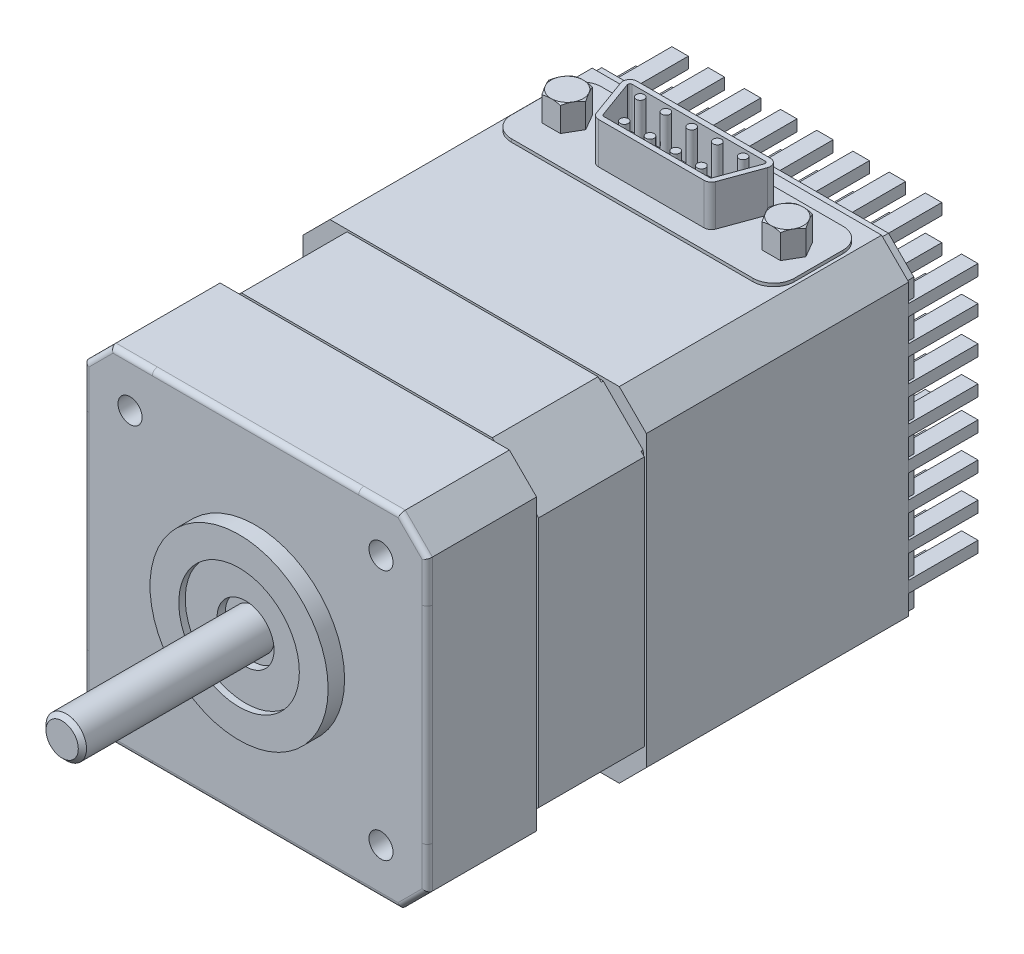
from build123d import *

# Parameters (mm, degrees)
EXTRUDE1_DEPTH          = 68.072
CUT_EXTRUDE_THIN1_DEPTH = 0.127
CUT_EXTRUDE_THIN2_DEPTH = 0.127
SKETCH5_R               = 10.9982
EXTRUDE2_DEPTH          = 2.032
SKETCH6_R               = 2.5019
EXTRUDE3_DEPTH          = 23.876
CHAMFER1_SIZE           = 0.508
SKETCH7_R               = 1.4859
CUT_EXTRUDE1_DEPTH      = 3.9624
CUT_EXTRUDE3_START      = -0.8001
SKETCH9_R               = 7.4422
SKETCH9_R_2             = 2.5019
CUT_EXTRUDE3_DEPTH      = 0.8001
CUT_EXTRUDE2_START      = -1.016
SKETCH8_R               = 3.5179
SKETCH8_R_2             = 2.5019
CUT_EXTRUDE2_DEPTH      = 1.016
CUT_EXTRUDE4_START      = -7.9375
CUT_EXTRUDE4_DEPTH      = 7.9375
FILLET1_R               = 1.016
FILLET2_R               = 0.635
SKETCH11_R              = 5.08
EXTRUDE4_DEPTH          = 0.508
DOME1_FACE_RADIUS       = 5.08
DOME1_HEIGHT            = 3.96875
DOME2_FACE_RADIUS       = 5.08
DOME2_HEIGHT            = 3.96875
DOME3_FACE_RADIUS       = 5.08
DOME3_HEIGHT            = 3.96875
DOME4_FACE_RADIUS       = 5.08
DOME4_HEIGHT            = 3.96875
EXTRUDE9_DEPTH          = 13.4874
FILLET7_R               = 0.635
EXTRUDE10_DEPTH         = 33.0835
CUT_EXTRUDE7_START      = -13.3096
CUT_EXTRUDE7_DEPTH      = 13.3096
CUT_EXTRUDE8_START      = -7.9375
SKETCH23_R              = 5.08
CUT_EXTRUDE8_DEPTH      = 7.9375
EXTRUDE14_DEPTH         = 7.9375
EXTRUDE14_DEPTH_BACK    = 0.635
SKETCH31_W              = 42.418
SKETCH31_H              = 42.418
SKETCH32_W              = 42.418
SKETCH32_H              = 42.418
CUT_EXTRUDE12_DEPTH     = 7.62
SKETCH33_W              = 42.418
SKETCH33_H              = 42.418
CUT_EXTRUDE13_DEPTH     = 1.016
EXTRUDE15_START         = -1.016
SKETCH34_W              = 2.032
SKETCH34_H              = 1.397
EXTRUDE15_DEPTH         = 8.636
LPATTERN2_COUNT         = 5
LPATTERN2_PITCH         = 4.2926
MIRROR1_START           = -1.016
MIRROR1_COPY_1_SKETCH_W = 2.032
MIRROR1_COPY_1_SKETCH_H = 1.397
MIRROR1_COPY_1_DEPTH    = 8.636
MIRROR1_COPY_2_SKETCH_W = 2.032
MIRROR1_COPY_2_SKETCH_H = 1.397
MIRROR1_COPY_2_DEPTH    = 8.636
MIRROR1_COPY_3_SKETCH_W = 2.032
MIRROR1_COPY_3_SKETCH_H = 1.397
MIRROR1_COPY_3_DEPTH    = 8.636
MIRROR1_COPY_4_SKETCH_W = 2.032
MIRROR1_COPY_4_SKETCH_H = 1.397
MIRROR1_COPY_4_DEPTH    = 8.636
SKETCH35_W              = 2.032
SKETCH35_H              = 1.397
CUT_EXTRUDE14_DEPTH     = 90.503379523
CUT_EXTRUDE16_DEPTH     = 1.27
SKETCH25_W              = 34.925
SKETCH25_H              = 11.1125
EXTRUDE11_DEPTH         = 0.381
EXTRUDE12_DEPTH         = 3.175
SKETCH29_OUTSIDE_W      = 69.3
SKETCH29_OUTSIDE_H      = 118.83
SKETCH29_OUTSIDE_R      = 1.9812
CUT_EXTRUDE11_DEPTH     = 0.762
CUT_EXTRUDE11_DRAFT     = -60
EXTRUDE13_DEPTH         = 5.08
FILLET8_R               = 0.889
SKETCH28_R              = 0.508
CUT_EXTRUDE10_DEPTH     = 5.08
FILLET9_R               = 2.54


with BuildPart() as part:
    # Sketch2 → Extrude1 (new body)
    with BuildSketch(Plane.XY):
        with BuildLine():
            Line((-15.494, 21.209), (15.494, 21.209))
            ThreePointArc((15.494, 21.209), (19.535115254, 19.535115254), (21.209, 15.494))
            Line((21.209, 15.494), (21.209, -15.494))
            ThreePointArc((21.209, -15.494), (19.535115254, -19.535115254), (15.494, -21.209))
            Line((15.494, -21.209), (-15.494, -21.209))
            ThreePointArc((-15.494, -21.209), (-19.535115254, -19.535115254), (-21.209, -15.494))
            Line((-21.209, -15.494), (-21.209, 15.494))
            ThreePointArc((-21.209, 15.494), (-19.535115254, 19.535115254), (-15.494, 21.209))
        make_face()
    extrude(amount=-EXTRUDE1_DEPTH)

    # Sketch3 → Cut-Extrude-Thin1 (cut, symmetric)
    with BuildSketch(Plane.XY.offset(-13.6144)):
        with BuildLine():
            Line((15.494, 21.59), (-15.494, 21.59))
            ThreePointArc((-15.494, 21.59), (-19.804522938, 19.804522938), (-21.59, 15.494))
            Line((-21.59, 15.494), (-21.59, -15.494))
            ThreePointArc((-21.59, -15.494), (-19.804522938, -19.804522938), (-15.494, -21.59))
            Line((-15.494, -21.59), (15.494, -21.59))
            ThreePointArc((15.494, -21.59), (19.804522938, -19.804522938), (21.59, -15.494))
            Line((21.59, -15.494), (21.59, 15.494))
            ThreePointArc((21.59, 15.494), (19.804522938, 19.804522938), (15.494, 21.59))
        make_face()
        with BuildLine():
            Line((15.494, 20.828), (-15.494, 20.828))
            ThreePointArc((-15.494, 20.828), (-19.265707571, 19.265707571), (-20.828, 15.494))
            Line((-20.828, 15.494), (-20.828, -15.494))
            ThreePointArc((-20.828, -15.494), (-19.265707571, -19.265707571), (-15.494, -20.828))
            Line((-15.494, -20.828), (15.494, -20.828))
            ThreePointArc((15.494, -20.828), (19.265707571, -19.265707571), (20.828, -15.494))
            Line((20.828, -15.494), (20.828, 15.494))
            ThreePointArc((20.828, 15.494), (19.265707571, 19.265707571), (15.494, 20.828))
        make_face(mode=Mode.SUBTRACT)
    extrude(amount=CUT_EXTRUDE_THIN1_DEPTH, both=True, mode=Mode.SUBTRACT)

    # Sketch4 → Cut-Extrude-Thin2 (cut, symmetric)
    with BuildSketch(Plane(origin=(0, 0, -26.924), x_dir=(-1, 0, 0), z_dir=(0, 0, -1))):
        with BuildLine():
            Line((15.494, 21.59), (-15.494, 21.59))
            ThreePointArc((-15.494, 21.59), (-19.804522938, 19.804522938), (-21.59, 15.494))
            Line((-21.59, 15.494), (-21.59, -15.494))
            ThreePointArc((-21.59, -15.494), (-19.804522938, -19.804522938), (-15.494, -21.59))
            Line((-15.494, -21.59), (15.494, -21.59))
            ThreePointArc((15.494, -21.59), (19.804522938, -19.804522938), (21.59, -15.494))
            Line((21.59, -15.494), (21.59, 15.494))
            ThreePointArc((21.59, 15.494), (19.804522938, 19.804522938), (15.494, 21.59))
        make_face()
        with BuildLine():
            Line((15.494, 20.828), (-15.494, 20.828))
            ThreePointArc((-15.494, 20.828), (-19.265707571, 19.265707571), (-20.828, 15.494))
            Line((-20.828, 15.494), (-20.828, -15.494))
            ThreePointArc((-20.828, -15.494), (-19.265707571, -19.265707571), (-15.494, -20.828))
            Line((-15.494, -20.828), (15.494, -20.828))
            ThreePointArc((15.494, -20.828), (19.265707571, -19.265707571), (20.828, -15.494))
            Line((20.828, -15.494), (20.828, 15.494))
            ThreePointArc((20.828, 15.494), (19.265707571, 19.265707571), (15.494, 20.828))
        make_face(mode=Mode.SUBTRACT)
    extrude(amount=CUT_EXTRUDE_THIN2_DEPTH, both=True, mode=Mode.SUBTRACT)

    # Sketch5 → Extrude2 (add)
    with BuildSketch(Plane.XY):
        Circle(SKETCH5_R)
    extrude(amount=EXTRUDE2_DEPTH)

    # Sketch6 → Extrude3 (add)
    with BuildSketch(Plane.XY):
        Circle(SKETCH6_R)
    extrude(amount=EXTRUDE3_DEPTH)

    # Chamfer1
    chamfer1_edges = [part.edges().sort_by_distance(p)[0] for p in [
        (-2.5019, 0, 23.876),
    ]]
    chamfer(chamfer1_edges, length=CHAMFER1_SIZE)

    # Sketch7 → Cut-Extrude1 (cut)
    with BuildSketch(Plane.XY):
        with Locations((15.494, 15.494)):
            Circle(SKETCH7_R)
        with Locations((15.494, -15.494)):
            Circle(SKETCH7_R)
        with Locations((-15.494, -15.494)):
            Circle(SKETCH7_R)
        with Locations((-15.494, 15.494)):
            Circle(SKETCH7_R)
    extrude(amount=-CUT_EXTRUDE1_DEPTH, mode=Mode.SUBTRACT)

    # Sketch9 → Cut-Extrude3 (cut)
    with BuildSketch(Plane.XY.offset(2.032).offset(CUT_EXTRUDE3_START)):
        Circle(SKETCH9_R)
        Circle(SKETCH9_R_2, mode=Mode.SUBTRACT)
    extrude(amount=CUT_EXTRUDE3_DEPTH, mode=Mode.SUBTRACT)

    # Sketch8 → Cut-Extrude2 (cut)
    with BuildSketch(Plane.XY.offset(1.2319).offset(CUT_EXTRUDE2_START)):
        Circle(SKETCH8_R)
        Circle(SKETCH8_R_2, mode=Mode.SUBTRACT)
    extrude(amount=CUT_EXTRUDE2_DEPTH, mode=Mode.SUBTRACT)

    # Sketch10 → Cut-Extrude4 (cut)
    with BuildSketch(Plane(origin=(0, 0, -68.072), x_dir=(-1, 0, 0), z_dir=(0, 0, -1)).offset(CUT_EXTRUDE4_START)):
        with BuildLine():
            Line((9.779, 15.494), (9.779, 21.209))
            Line((9.779, 21.209), (21.209, 21.209))
            Line((21.209, 21.209), (21.209, 9.779))
            Line((21.209, 9.779), (15.494, 9.779))
            ThreePointArc((15.494, 9.779), (11.452884746, 11.452884746), (9.779, 15.494))
        make_face()
        with BuildLine():
            Line((-9.779, 15.494), (-9.779, 21.209))
            Line((-9.779, 21.209), (-21.209, 21.209))
            Line((-21.209, 21.209), (-21.209, 9.779))
            Line((-21.209, 9.779), (-15.494, 9.779))
            ThreePointArc((-15.494, 9.779), (-11.452884746, 11.452884746), (-9.779, 15.494))
        make_face()
        with BuildLine():
            Line((-21.209, -9.779), (-15.494, -9.779))
            ThreePointArc((-15.494, -9.779), (-11.452884746, -11.452884746), (-9.779, -15.494))
            Line((-9.779, -15.494), (-9.779, -21.209))
            Line((-9.779, -21.209), (-21.209, -21.209))
            Line((-21.209, -21.209), (-21.209, -9.779))
        make_face()
        with BuildLine():
            Line((9.779, -15.494), (9.779, -21.209))
            Line((9.779, -21.209), (21.209, -21.209))
            Line((21.209, -21.209), (21.209, -9.779))
            Line((21.209, -9.779), (15.494, -9.779))
            ThreePointArc((15.494, -9.779), (11.452884746, -11.452884746), (9.779, -15.494))
        make_face()
    extrude(amount=CUT_EXTRUDE4_DEPTH, mode=Mode.SUBTRACT)

    # Fillet1
    fillet1_edges = [part.edges().sort_by_distance(p)[0] for p in [
        (-9.779, 21.209, -64.10325),
        (-21.209, 9.779, -64.10325),
        (21.209, 9.779, -64.10325),
        (9.779, 21.209, -64.10325),
        (9.779, -21.209, -64.10325),
        (21.209, -9.779, -64.10325),
        (-9.779, -21.209, -64.10325),
        (-21.209, -9.779, -64.10325),
    ]]
    fillet(fillet1_edges, radius=FILLET1_R)

    # Fillet2
    fillet2_edges = [part.edges().sort_by_distance(p)[0] for p in [
        (-19.535115254, 19.535115254, -60.1345),
        (-21.209, 12.1285, -60.1345),
        (-12.1285, 21.209, -60.1345),
        (-11.452884746, 11.452884746, -68.072),
        (-17.8435, 9.779, -68.072),
        (12.1285, 21.209, -60.1345),
        (21.209, 12.1285, -60.1345),
        (19.535115254, 19.535115254, -60.1345),
        (11.452884746, 11.452884746, -68.072),
        (9.779, 17.8435, -68.072),
        (21.209, -12.1285, -60.1345),
        (12.1285, -21.209, -60.1345),
        (19.535115254, -19.535115254, -60.1345),
        (11.452884746, -11.452884746, -68.072),
        (17.8435, -9.779, -68.072),
        (-12.1285, -21.209, -60.1345),
        (-21.209, -12.1285, -60.1345),
        (-19.535115254, -19.535115254, -60.1345),
        (-11.452884746, -11.452884746, -68.072),
        (-9.779, -17.8435, -68.072),
        (-17.8435, -9.779, -68.072),
        (0, -21.209, -68.072),
        (-21.209, 0, -68.072),
        (-9.779, 17.8435, -68.072),
        (0, 21.209, -68.072),
        (17.8435, 9.779, -68.072),
        (21.209, 0, -68.072),
        (9.779, -17.8435, -68.072),
        (20.91142049, 9.48142049, -68.072),
        (9.48142049, 20.91142049, -68.072),
        (-9.48142049, 20.91142049, -68.072),
        (-20.91142049, 9.48142049, -68.072),
        (9.48142049, -20.91142049, -68.072),
        (20.91142049, -9.48142049, -68.072),
        (-9.48142049, -20.91142049, -68.072),
        (-20.91142049, -9.48142049, -68.072),
        (0, 21.209, 0),
        (19.535115254, 19.535115254, 0),
        (21.209, 0, 0),
        (19.535115254, -19.535115254, 0),
        (0, -21.209, 0),
        (-19.535115254, -19.535115254, 0),
        (-21.209, 0, 0),
        (-19.535115254, 19.535115254, 0),
    ]]
    fillet(fillet2_edges, radius=FILLET2_R)

    # Sketch11 → Extrude4 (add)
    with BuildSketch(Plane(origin=(0, 0, -60.1345), x_dir=(-1, 0, 0), z_dir=(0, 0, -1))):
        with Locations(Location((-15.494, 15.494, 0), (0, 0, 180))):
            Circle(SKETCH11_R)
        with Locations((15.494, 15.494)):
            Circle(SKETCH11_R)
        with Locations((15.494, -15.494)):
            Circle(SKETCH11_R)
        with Locations(Location((-15.494, -15.494, 0), (0, 0, 180))):
            Circle(SKETCH11_R)
    extrude(amount=EXTRUDE4_DEPTH)

    # Dome1: an elliptical dome of height H over a round flat face of radius A is half a spheroid: the quarter ellipse of half axes A and H revolved about the face's axis
    with BuildSketch(Plane((15.494, -15.494, -60.6425), x_dir=(0, -1, 0), z_dir=(1, 0, 0)), mode=Mode.PRIVATE) as dome1_quarter:
        Ellipse(DOME1_FACE_RADIUS, DOME1_HEIGHT)
        Rectangle(DOME1_FACE_RADIUS, DOME1_HEIGHT, align=(Align.MIN, Align.MIN), mode=Mode.INTERSECT)
    revolve(dome1_quarter.sketch, axis=Axis((15.494, -15.494, -60.6425), (0, 0, -1)))

    # Dome2: an elliptical dome of height H over a round flat face of radius A is half a spheroid: the quarter ellipse of half axes A and H revolved about the face's axis
    with BuildSketch(Plane((-15.494, -15.494, -60.6425), x_dir=(0, -1, 0), z_dir=(1, 0, 0)), mode=Mode.PRIVATE) as dome2_quarter:
        Ellipse(DOME2_FACE_RADIUS, DOME2_HEIGHT)
        Rectangle(DOME2_FACE_RADIUS, DOME2_HEIGHT, align=(Align.MIN, Align.MIN), mode=Mode.INTERSECT)
    revolve(dome2_quarter.sketch, axis=Axis((-15.494, -15.494, -60.6425), (0, 0, -1)))

    # Dome3: an elliptical dome of height H over a round flat face of radius A is half a spheroid: the quarter ellipse of half axes A and H revolved about the face's axis
    with BuildSketch(Plane((15.494, 15.494, -60.6425), x_dir=(0, -1, 0), z_dir=(1, 0, 0)), mode=Mode.PRIVATE) as dome3_quarter:
        Ellipse(DOME3_FACE_RADIUS, DOME3_HEIGHT)
        Rectangle(DOME3_FACE_RADIUS, DOME3_HEIGHT, align=(Align.MIN, Align.MIN), mode=Mode.INTERSECT)
    revolve(dome3_quarter.sketch, axis=Axis((15.494, 15.494, -60.6425), (0, 0, -1)))

    # Dome4: an elliptical dome of height H over a round flat face of radius A is half a spheroid: the quarter ellipse of half axes A and H revolved about the face's axis
    with BuildSketch(Plane((-15.494, 15.494, -60.6425), x_dir=(0, -1, 0), z_dir=(1, 0, 0)), mode=Mode.PRIVATE) as dome4_quarter:
        Ellipse(DOME4_FACE_RADIUS, DOME4_HEIGHT)
        Rectangle(DOME4_FACE_RADIUS, DOME4_HEIGHT, align=(Align.MIN, Align.MIN), mode=Mode.INTERSECT)
    revolve(dome4_quarter.sketch, axis=Axis((-15.494, 15.494, -60.6425), (0, 0, -1)))

    # Sketch18 → Extrude9 (add)
    with BuildSketch(Plane.XY):
        with BuildLine():
            Line((-21.209, 17.861230509), (-17.861230509, 21.209))
            Line((-17.861230509, 21.209), (-12.7381, 21.209))
            Line((-12.7381, 21.209), (-12.7381, 15.494))
            ThreePointArc((-12.7381, 15.494), (-17.442715578, 17.442715578), (-15.494, 12.7381))
            Line((-15.494, 12.7381), (-21.209, 12.7381))
            Line((-21.209, 12.7381), (-21.209, 17.861230509))
        make_face()
        with BuildLine():
            Line((12.7381, 15.494), (12.7381, 21.209))
            Line((12.7381, 21.209), (17.861230509, 21.209))
            Line((17.861230509, 21.209), (21.209, 17.861230509))
            Line((21.209, 17.861230509), (21.209, 12.7381))
            Line((21.209, 12.7381), (15.494, 12.7381))
            ThreePointArc((15.494, 12.7381), (17.442715578, 17.442715578), (12.7381, 15.494))
        make_face()
        with BuildLine():
            Line((21.209, -17.861230509), (17.861230509, -21.209))
            Line((17.861230509, -21.209), (12.7381, -21.209))
            Line((12.7381, -21.209), (12.7381, -15.494))
            ThreePointArc((12.7381, -15.494), (17.442715578, -17.442715578), (15.494, -12.7381))
            Line((15.494, -12.7381), (21.209, -12.7381))
            Line((21.209, -12.7381), (21.209, -17.861230509))
        make_face()
        with BuildLine():
            Line((-12.7381, -15.494), (-12.7381, -21.209))
            Line((-12.7381, -21.209), (-17.861230509, -21.209))
            Line((-17.861230509, -21.209), (-21.209, -17.861230509))
            Line((-21.209, -17.861230509), (-21.209, -12.7381))
            Line((-21.209, -12.7381), (-15.494, -12.7381))
            ThreePointArc((-15.494, -12.7381), (-17.442715578, -17.442715578), (-12.7381, -15.494))
        make_face()
    extrude(amount=-EXTRUDE9_DEPTH)

    # Fillet7
    # the kernel refuses this fillet: 0.635 mm, written as the material it takes off along each edge
    with BuildSketch(Plane(origin=(-19.448730509, 21.209, 0), x_dir=(0, -1, 0), z_dir=(1, 0, 0)), Plane(origin=(-21.209, 11.1506, 0), x_dir=(1, 0, 0), z_dir=(0, 1, 0)), Plane(origin=(21.209, 19.448730509, 0), x_dir=(-1, 0, 0), z_dir=(0, -1, 0)), Plane(origin=(11.1506, 21.209, 0), x_dir=(0, -1, 0), z_dir=(1, 0, 0)), Plane(origin=(-21.209, -19.448730509, 0), x_dir=(1, 0, 0), z_dir=(0, 1, 0)), Plane(origin=(-11.1506, -21.209, 0), x_dir=(0, 1, 0), z_dir=(-1, 0, 0)), Plane(origin=(19.448730509, -21.209, 0), x_dir=(0, 1, 0), z_dir=(-1, 0, 0)), Plane(origin=(21.209, -11.1506, 0), x_dir=(-1, 0, 0), z_dir=(0, -1, 0))) as fillet7_piece_1:
        with BuildLine():
            CenterArc((FILLET7_R, FILLET7_R), FILLET7_R, 180, 90)
            Line((0, FILLET7_R), (0, 0))
            Line((0, 0), (FILLET7_R, 0))
        make_face()
    extrude(amount=8.298130509, mode=Mode.SUBTRACT)
    with BuildSketch(Plane(origin=(-22.331532015, 16.738698494, 0), x_dir=(0.7071067811865462, -0.7071067811865487, 0), z_dir=(0.7071067811865487, 0.7071067811865464, 0)), Plane(origin=(16.738698494, 22.331532015, 0), x_dir=(-0.7071067811865462, -0.7071067811865487, 0), z_dir=(0.7071067811865487, -0.7071067811865464, 0)), Plane(origin=(-16.738698494, -22.331532015, 0), x_dir=(0.7071067811865464, 0.7071067811865488, 0), z_dir=(-0.7071067811865487, 0.7071067811865464, 0))) as fillet7_piece_2:
        with BuildLine():
            CenterArc((FILLET7_R, FILLET7_R), FILLET7_R, 180, 90)
            Line((0, FILLET7_R), (0, 0))
            Line((0, 0), (FILLET7_R, 0))
        make_face()
    extrude(amount=7.909461018, mode=Mode.SUBTRACT)
    with BuildSketch(Plane(origin=(22.331532015, -16.738698494, 0), x_dir=(0, 0, -1), z_dir=(-0.7071067811865487, -0.7071067811865464, 0))) as fillet7_piece_3:
        with BuildLine():
            CenterArc((FILLET7_R, -FILLET7_R), FILLET7_R, 90, 90)
            Line((0, -FILLET7_R), (0, 0))
            Line((0, 0), (FILLET7_R, 0))
        make_face()
    extrude(amount=7.909461018, mode=Mode.SUBTRACT)

    # Sketch19 → Extrude10 (add)
    with BuildSketch(Plane.XY.offset(-27.051)):
        with BuildLine():
            Line((12.7381, 21.209), (12.7381, 15.494))
            ThreePointArc((12.7381, 15.494), (17.442715578, 17.442715578), (15.494, 12.7381))
            Line((15.494, 12.7381), (21.209, 12.7381))
            Line((21.209, 12.7381), (21.209, 17.861230509))
            Line((21.209, 17.861230509), (17.861230509, 21.209))
            Line((17.861230509, 21.209), (12.7381, 21.209))
        make_face()
        with BuildLine():
            Line((-21.209, 12.7381), (-15.494, 12.7381))
            ThreePointArc((-15.494, 12.7381), (-17.442715578, 17.442715578), (-12.7381, 15.494))
            Line((-12.7381, 15.494), (-12.7381, 21.209))
            Line((-12.7381, 21.209), (-17.861230509, 21.209))
            Line((-17.861230509, 21.209), (-21.209, 17.861230509))
            Line((-21.209, 17.861230509), (-21.209, 12.7381))
        make_face()
        with BuildLine():
            Line((-12.7381, -21.209), (-12.7381, -15.494))
            ThreePointArc((-12.7381, -15.494), (-17.442715578, -17.442715578), (-15.494, -12.7381))
            Line((-15.494, -12.7381), (-21.209, -12.7381))
            Line((-21.209, -12.7381), (-21.209, -17.861230509))
            Line((-21.209, -17.861230509), (-17.861230509, -21.209))
            Line((-17.861230509, -21.209), (-12.7381, -21.209))
        make_face()
        with BuildLine():
            Line((17.861230509, -21.209), (21.209, -17.861230509))
            Line((21.209, -17.861230509), (21.209, -12.7381))
            Line((21.209, -12.7381), (15.494, -12.7381))
            ThreePointArc((15.494, -12.7381), (17.442715578, -17.442715578), (12.7381, -15.494))
            Line((12.7381, -15.494), (12.7381, -21.209))
            Line((12.7381, -21.209), (17.861230509, -21.209))
        make_face()
    extrude(amount=-EXTRUDE10_DEPTH)

    # Sketch22 → Cut-Extrude7 (cut)
    with BuildSketch(Plane.XY.offset(-13.7414).offset(CUT_EXTRUDE7_START)):
        Polygon((15.494, 21.209), (21.209, 15.494), (21.209, 21.209), align=None)
        Polygon((-21.209, 21.209), (-15.494, 21.209), (-21.209, 15.494), align=None)
        Polygon((-15.494, -21.209), (-21.209, -15.494), (-21.209, -21.209), align=None)
        Polygon((21.209, -21.209), (15.494, -21.209), (21.209, -15.494), align=None)
    extrude(amount=CUT_EXTRUDE7_DEPTH, mode=Mode.SUBTRACT)

    # Sketch23 → Cut-Extrude8 (cut)
    with BuildSketch(Plane(origin=(0, 0, -68.072), x_dir=(-1, 0, 0), z_dir=(0, 0, -1)).offset(CUT_EXTRUDE8_START)):
        with Locations((-15.494, 15.494)):
            Circle(SKETCH23_R)
        with Locations((15.494, 15.494)):
            Circle(SKETCH23_R)
        with Locations((15.494, -15.494)):
            Circle(SKETCH23_R)
        with Locations((-15.494, -15.494)):
            Circle(SKETCH23_R)
    extrude(amount=CUT_EXTRUDE8_DEPTH, mode=Mode.SUBTRACT)

    # Sketch31 → Extrude14 (add, two sides: drawn at the far end of the back side and taken through both)
    with BuildSketch(Plane(origin=(0, 0, -60.1345), x_dir=(-1, 0, 0), z_dir=(0, 0, -1)).offset(-EXTRUDE14_DEPTH_BACK)):
        Rectangle(SKETCH31_W, SKETCH31_H)
    extrude(amount=EXTRUDE14_DEPTH + EXTRUDE14_DEPTH_BACK)

    # Sketch32 → Cut-Extrude12 (cut)
    with BuildSketch(Plane(origin=(0, 0, -68.072), x_dir=(-1, 0, 0), z_dir=(0, 0, -1))):
        Rectangle(SKETCH32_W, SKETCH32_H)
    extrude(amount=-CUT_EXTRUDE12_DEPTH, mode=Mode.SUBTRACT)

    # Sketch33 → Cut-Extrude13 (cut)
    with BuildSketch(Plane(origin=(0, 0, -60.452), x_dir=(-1, 0, 0), z_dir=(0, 0, -1))):
        Rectangle(SKETCH33_W, SKETCH33_H)
        Polygon((-20.828, 17.703415142), (-17.703415142, 20.828), (17.703415142, 20.828), (20.828, 17.703415142), (20.828, -17.703415142), (17.703415142, -20.828), (-17.703415142, -20.828), (-20.828, -17.703415142), align=None, mode=Mode.SUBTRACT)
    extrude(amount=-CUT_EXTRUDE13_DEPTH, mode=Mode.SUBTRACT)

    # Sketch34 → Extrude15 (add)
    with BuildSketch(Plane(origin=(0, 0, -60.452), x_dir=(-1, 0, 0), z_dir=(0, 0, -1)).offset(EXTRUDE15_START)):
        with Locations((-2.2352, 1.9177)):
            Rectangle(SKETCH34_W, SKETCH34_H)
        with Locations((-6.7056, 1.9177)):
            Rectangle(SKETCH34_W, SKETCH34_H)
        with Locations((-11.176, 1.9177)):
            Rectangle(SKETCH34_W, SKETCH34_H)
        with Locations((-15.6464, 1.9177)):
            Rectangle(SKETCH34_W, SKETCH34_H)
        with Locations((-20.1168, 1.9177)):
            Rectangle(SKETCH34_W, SKETCH34_H)
        with Locations((20.1168, 1.9177)):
            Rectangle(SKETCH34_W, SKETCH34_H)
        with Locations((15.6464, 1.9177)):
            Rectangle(SKETCH34_W, SKETCH34_H)
        with Locations((11.176, 1.9177)):
            Rectangle(SKETCH34_W, SKETCH34_H)
        with Locations((6.7056, 1.9177)):
            Rectangle(SKETCH34_W, SKETCH34_H)
        with Locations((2.2352, 1.9177)):
            Rectangle(SKETCH34_W, SKETCH34_H)
    extrude15 = extrude(amount=EXTRUDE15_DEPTH)

    # LPattern2: Extrude15 ×5
    with Locations(*[(0, i * LPATTERN2_PITCH, 0) for i in range(1, LPATTERN2_COUNT)]):
        add(extrude15)

    # Mirror1: Extrude15 across plane
    add(extrude15.mirror(Plane.ZX))

    # Mirror1 copy 1 sketch → Mirror1 copy 1 (add)
    with BuildSketch(Plane(origin=(0, -4.2926, -60.452), x_dir=(-1, 0, 0), z_dir=(0, 0, -1)).offset(MIRROR1_START)):
        with Locations((-2.2352, -1.9177)):
            Rectangle(MIRROR1_COPY_1_SKETCH_W, MIRROR1_COPY_1_SKETCH_H)
        with Locations((-6.7056, -1.9177)):
            Rectangle(MIRROR1_COPY_1_SKETCH_W, MIRROR1_COPY_1_SKETCH_H)
        with Locations((-11.176, -1.9177)):
            Rectangle(MIRROR1_COPY_1_SKETCH_W, MIRROR1_COPY_1_SKETCH_H)
        with Locations((-15.6464, -1.9177)):
            Rectangle(MIRROR1_COPY_1_SKETCH_W, MIRROR1_COPY_1_SKETCH_H)
        with Locations((-20.1168, -1.9177)):
            Rectangle(MIRROR1_COPY_1_SKETCH_W, MIRROR1_COPY_1_SKETCH_H)
        with Locations((20.1168, -1.9177)):
            Rectangle(MIRROR1_COPY_1_SKETCH_W, MIRROR1_COPY_1_SKETCH_H)
        with Locations((15.6464, -1.9177)):
            Rectangle(MIRROR1_COPY_1_SKETCH_W, MIRROR1_COPY_1_SKETCH_H)
        with Locations((11.176, -1.9177)):
            Rectangle(MIRROR1_COPY_1_SKETCH_W, MIRROR1_COPY_1_SKETCH_H)
        with Locations((6.7056, -1.9177)):
            Rectangle(MIRROR1_COPY_1_SKETCH_W, MIRROR1_COPY_1_SKETCH_H)
        with Locations((2.2352, -1.9177)):
            Rectangle(MIRROR1_COPY_1_SKETCH_W, MIRROR1_COPY_1_SKETCH_H)
    extrude(amount=MIRROR1_COPY_1_DEPTH)

    # Mirror1 copy 2 sketch → Mirror1 copy 2 (add)
    with BuildSketch(Plane(origin=(0, -8.5852, -60.452), x_dir=(-1, 0, 0), z_dir=(0, 0, -1)).offset(MIRROR1_START)):
        with Locations((-2.2352, -1.9177)):
            Rectangle(MIRROR1_COPY_2_SKETCH_W, MIRROR1_COPY_2_SKETCH_H)
        with Locations((-6.7056, -1.9177)):
            Rectangle(MIRROR1_COPY_2_SKETCH_W, MIRROR1_COPY_2_SKETCH_H)
        with Locations((-11.176, -1.9177)):
            Rectangle(MIRROR1_COPY_2_SKETCH_W, MIRROR1_COPY_2_SKETCH_H)
        with Locations((-15.6464, -1.9177)):
            Rectangle(MIRROR1_COPY_2_SKETCH_W, MIRROR1_COPY_2_SKETCH_H)
        with Locations((-20.1168, -1.9177)):
            Rectangle(MIRROR1_COPY_2_SKETCH_W, MIRROR1_COPY_2_SKETCH_H)
        with Locations((20.1168, -1.9177)):
            Rectangle(MIRROR1_COPY_2_SKETCH_W, MIRROR1_COPY_2_SKETCH_H)
        with Locations((15.6464, -1.9177)):
            Rectangle(MIRROR1_COPY_2_SKETCH_W, MIRROR1_COPY_2_SKETCH_H)
        with Locations((11.176, -1.9177)):
            Rectangle(MIRROR1_COPY_2_SKETCH_W, MIRROR1_COPY_2_SKETCH_H)
        with Locations((6.7056, -1.9177)):
            Rectangle(MIRROR1_COPY_2_SKETCH_W, MIRROR1_COPY_2_SKETCH_H)
        with Locations((2.2352, -1.9177)):
            Rectangle(MIRROR1_COPY_2_SKETCH_W, MIRROR1_COPY_2_SKETCH_H)
    extrude(amount=MIRROR1_COPY_2_DEPTH)

    # Mirror1 copy 3 sketch → Mirror1 copy 3 (add)
    with BuildSketch(Plane(origin=(0, -12.8778, -60.452), x_dir=(-1, 0, 0), z_dir=(0, 0, -1)).offset(MIRROR1_START)):
        with Locations((-2.2352, -1.9177)):
            Rectangle(MIRROR1_COPY_3_SKETCH_W, MIRROR1_COPY_3_SKETCH_H)
        with Locations((-6.7056, -1.9177)):
            Rectangle(MIRROR1_COPY_3_SKETCH_W, MIRROR1_COPY_3_SKETCH_H)
        with Locations((-11.176, -1.9177)):
            Rectangle(MIRROR1_COPY_3_SKETCH_W, MIRROR1_COPY_3_SKETCH_H)
        with Locations((-15.6464, -1.9177)):
            Rectangle(MIRROR1_COPY_3_SKETCH_W, MIRROR1_COPY_3_SKETCH_H)
        with Locations((-20.1168, -1.9177)):
            Rectangle(MIRROR1_COPY_3_SKETCH_W, MIRROR1_COPY_3_SKETCH_H)
        with Locations((20.1168, -1.9177)):
            Rectangle(MIRROR1_COPY_3_SKETCH_W, MIRROR1_COPY_3_SKETCH_H)
        with Locations((15.6464, -1.9177)):
            Rectangle(MIRROR1_COPY_3_SKETCH_W, MIRROR1_COPY_3_SKETCH_H)
        with Locations((11.176, -1.9177)):
            Rectangle(MIRROR1_COPY_3_SKETCH_W, MIRROR1_COPY_3_SKETCH_H)
        with Locations((6.7056, -1.9177)):
            Rectangle(MIRROR1_COPY_3_SKETCH_W, MIRROR1_COPY_3_SKETCH_H)
        with Locations((2.2352, -1.9177)):
            Rectangle(MIRROR1_COPY_3_SKETCH_W, MIRROR1_COPY_3_SKETCH_H)
    extrude(amount=MIRROR1_COPY_3_DEPTH)

    # Mirror1 copy 4 sketch → Mirror1 copy 4 (add)
    with BuildSketch(Plane(origin=(0, -17.1704, -60.452), x_dir=(-1, 0, 0), z_dir=(0, 0, -1)).offset(MIRROR1_START)):
        with Locations((-2.2352, -1.9177)):
            Rectangle(MIRROR1_COPY_4_SKETCH_W, MIRROR1_COPY_4_SKETCH_H)
        with Locations((-6.7056, -1.9177)):
            Rectangle(MIRROR1_COPY_4_SKETCH_W, MIRROR1_COPY_4_SKETCH_H)
        with Locations((-11.176, -1.9177)):
            Rectangle(MIRROR1_COPY_4_SKETCH_W, MIRROR1_COPY_4_SKETCH_H)
        with Locations((-15.6464, -1.9177)):
            Rectangle(MIRROR1_COPY_4_SKETCH_W, MIRROR1_COPY_4_SKETCH_H)
        with Locations((-20.1168, -1.9177)):
            Rectangle(MIRROR1_COPY_4_SKETCH_W, MIRROR1_COPY_4_SKETCH_H)
        with Locations((20.1168, -1.9177)):
            Rectangle(MIRROR1_COPY_4_SKETCH_W, MIRROR1_COPY_4_SKETCH_H)
        with Locations((15.6464, -1.9177)):
            Rectangle(MIRROR1_COPY_4_SKETCH_W, MIRROR1_COPY_4_SKETCH_H)
        with Locations((11.176, -1.9177)):
            Rectangle(MIRROR1_COPY_4_SKETCH_W, MIRROR1_COPY_4_SKETCH_H)
        with Locations((6.7056, -1.9177)):
            Rectangle(MIRROR1_COPY_4_SKETCH_W, MIRROR1_COPY_4_SKETCH_H)
        with Locations((2.2352, -1.9177)):
            Rectangle(MIRROR1_COPY_4_SKETCH_W, MIRROR1_COPY_4_SKETCH_H)
    extrude(amount=MIRROR1_COPY_4_DEPTH)

    # Sketch35 → Cut-Extrude14 (cut, through all)
    with BuildSketch(Plane(origin=(0, 0, -60.452), x_dir=(-1, 0, 0), z_dir=(0, 0, -1))):
        with Locations((20.1168, 19.0881)):
            Rectangle(SKETCH35_W, SKETCH35_H)
        with Locations((20.1168, -19.0881)):
            Rectangle(SKETCH35_W, SKETCH35_H)
        with Locations((-20.1168, 19.0881)):
            Rectangle(SKETCH35_W, SKETCH35_H)
        with Locations((-20.1168, -19.0881)):
            Rectangle(SKETCH35_W, SKETCH35_H)
    extrude(amount=CUT_EXTRUDE14_DEPTH, mode=Mode.SUBTRACT)

    # Sketch37 → Cut-Extrude16 (cut)
    with BuildSketch(Plane(origin=(0, 0, -59.436), x_dir=(-1, 0, 0), z_dir=(0, 0, -1))):
        Polygon((-21.1328, -17.398615142), (-21.1328, -19.7866), (-18.744815142, -19.7866), align=None)
        Polygon((21.1328, -19.7866), (21.1328, -17.398615142), (18.744815142, -19.7866), align=None)
        Polygon((21.1328, 18.3896), (21.1328, 19.7866), (18.744815142, 19.7866), (20.141815142, 18.3896), align=None)
        Polygon((-18.744815142, 19.7866), (-21.1328, 17.398615142), (-21.1328, 19.7866), align=None)
    extrude(amount=CUT_EXTRUDE16_DEPTH, mode=Mode.SUBTRACT)

    # Sketch25 → Extrude11 (add)
    with BuildSketch(Plane(origin=(0, 21.209, 0), x_dir=(-1, 0, 0), z_dir=(0, 1, 0))):
        with Locations((0, -52.07)):
            Rectangle(SKETCH25_W, SKETCH25_H)
    extrude(amount=EXTRUDE11_DEPTH)

    # Sketch26 → Extrude12 (add)
    with BuildSketch(Plane(origin=(0, 21.59, 0), x_dir=(-1, 0, 0), z_dir=(0, 1, 0))):
        Polygon((-12.445153647, -54.0512), (-11.301307293, -52.07), (-12.445153647, -50.0888), (-14.732846353, -50.0888), (-15.876692707, -52.07), (-14.732846353, -54.0512), align=None)
        Polygon((14.732846353, -54.0512), (12.445153647, -54.0512), (11.301307293, -52.07), (12.445153647, -50.0888), (14.732846353, -50.0888), (15.876692707, -52.07), align=None)
    extrude(amount=EXTRUDE12_DEPTH)


with BuildPart() as cut_extrude11_tool:
    # Sketch29 outside → Cut-Extrude11 (with draft: the straight prism first)
    with BuildSketch(Plane(origin=(0, 24.765, 0), x_dir=(-1, 0, 0), z_dir=(0, 1, 0))):
        with Locations((0, -22.098)):
            Rectangle(SKETCH29_OUTSIDE_W, SKETCH29_OUTSIDE_H)
        with Locations((-13.589, -52.07)):
            Circle(SKETCH29_OUTSIDE_R, mode=Mode.SUBTRACT)
        with Locations((13.589, -52.07)):
            Circle(SKETCH29_OUTSIDE_R, mode=Mode.SUBTRACT)
    extrude(amount=-CUT_EXTRUDE11_DEPTH)
    # Cut-Extrude11: the draft: its side faces are tilted about the plane it starts from
    cut_extrude11_sides = [cut_extrude11_tool.faces().sort_by_distance(p)[0] for p in [
        (0, 24.384, -81.513),
        (-34.65, 24.384, -22.098),
        (0, 24.384, 37.317),
        (34.65, 24.384, -22.098),
        (15.5702, 24.384, -52.07),
        (-11.6078, 24.384, -52.07),
    ]]
    draft(cut_extrude11_sides, Plane(origin=(0, 24.765, 0), x_dir=(-1, 0, 0), z_dir=(0, 1, 0)), CUT_EXTRUDE11_DRAFT)


with BuildPart() as part_1:
    add(part.part)

    # Cut-Extrude11: cut by cut_extrude11_tool
    add(cut_extrude11_tool.part, mode=Mode.SUBTRACT)

    # Sketch27 → Extrude13 (add)
    with BuildSketch(Plane(origin=(0, 21.59, 0), x_dir=(-1, 0, 0), z_dir=(0, 1, 0))):
        Polygon((-9.496562785, -55.34025), (9.496562785, -55.34025), (7.14375, -48.87595), (-7.14375, -48.87595), align=None)
    extrude(amount=EXTRUDE13_DEPTH)

    # Fillet8
    fillet8_edges = [part_1.edges().sort_by_distance(p)[0] for p in [
        (7.14375, 24.13, -48.87595),
        (9.496562785, 24.13, -55.34025),
        (-9.496562785, 24.13, -55.34025),
        (-7.14375, 24.13, -48.87595),
    ]]
    fillet(fillet8_edges, radius=FILLET8_R)

    # Sketch28 → Cut-Extrude10 (cut)
    with BuildSketch(Plane(origin=(0, 26.67, 0), x_dir=(-1, 0, 0), z_dir=(0, 1, 0))):
        with BuildLine():
            Line((-8.226939207, -54.70525), (8.226939207, -54.70525))
            ThreePointArc((8.226939207, -54.70525), (8.435003827, -54.596938415), (8.465621133, -54.364376884))
            Line((8.465621133, -54.364376884), (6.759947424, -49.678076884))
            ThreePointArc((6.759947424, -49.678076884), (6.666953913, -49.556885381), (6.521265499, -49.51095))
            Line((6.521265499, -49.51095), (-6.521265499, -49.51095))
            ThreePointArc((-6.521265499, -49.51095), (-6.666953913, -49.556885381), (-6.759947424, -49.678076884))
            Line((-6.759947424, -49.678076884), (-8.465621133, -54.364376884))
            ThreePointArc((-8.465621133, -54.364376884), (-8.435003827, -54.596938415), (-8.226939207, -54.70525))
        make_face()
        with Locations(Location((4.7625, -50.292, 0), (0, 0, 90))):
            Circle(SKETCH28_R, mode=Mode.SUBTRACT)
        with Locations(Location((1.5875, -50.292, 0), (0, 0, 90))):
            Circle(SKETCH28_R, mode=Mode.SUBTRACT)
        with Locations(Location((-1.5875, -50.292, 0), (0, 0, 90))):
            Circle(SKETCH28_R, mode=Mode.SUBTRACT)
        with Locations(Location((-4.7625, -50.292, 0), (0, 0, 90))):
            Circle(SKETCH28_R, mode=Mode.SUBTRACT)
        with Locations(Location((-6.35, -53.848, 0), (0, 0, 90))):
            Circle(SKETCH28_R, mode=Mode.SUBTRACT)
        with Locations(Location((-3.175, -53.848, 0), (0, 0, 90))):
            Circle(SKETCH28_R, mode=Mode.SUBTRACT)
        with Locations(Location((0, -53.848, 0), (0, 0, 90))):
            Circle(SKETCH28_R, mode=Mode.SUBTRACT)
        with Locations(Location((3.175, -53.848, 0), (0, 0, 90))):
            Circle(SKETCH28_R, mode=Mode.SUBTRACT)
        with Locations(Location((6.35, -53.848, 0), (0, 0, 90))):
            Circle(SKETCH28_R, mode=Mode.SUBTRACT)
    extrude(amount=-CUT_EXTRUDE10_DEPTH, mode=Mode.SUBTRACT)

    # Fillet9
    fillet9_edges = [part_1.edges().sort_by_distance(p)[0] for p in [
        (17.4625, 21.3995, -57.62625),
        (-17.4625, 21.3995, -57.62625),
        (-17.4625, 21.3995, -46.51375),
        (17.4625, 21.3995, -46.51375),
    ]]
    fillet(fillet9_edges, radius=FILLET9_R)


solid = part_1.part
